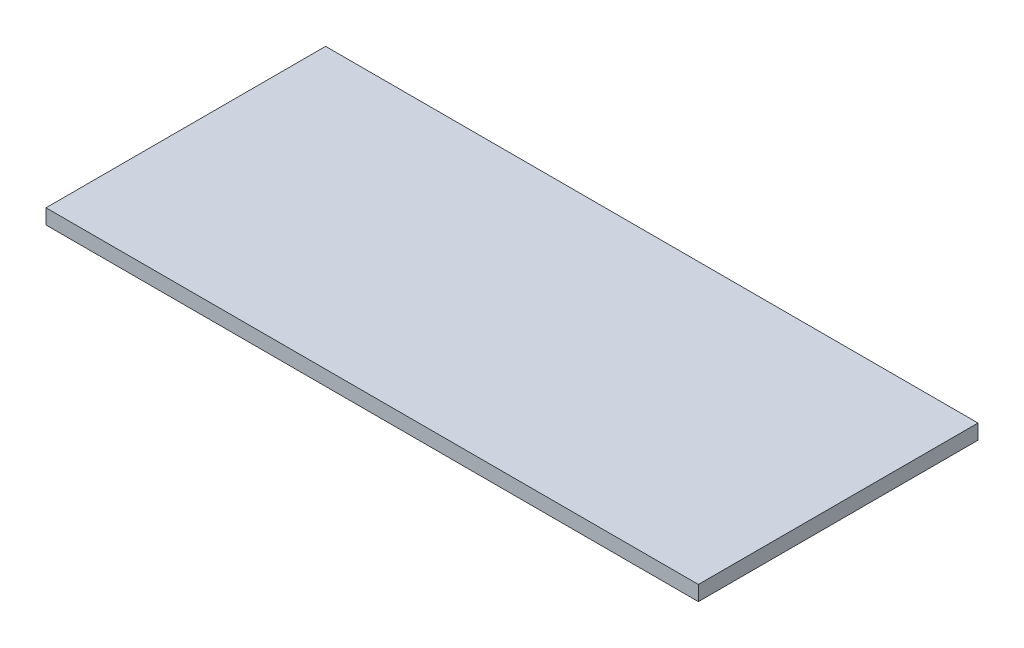
from build123d import *

# Parameters (mm, degrees)
SKETCH1_W           = 70
SKETCH1_H           = 30
BOSS_EXTRUDE1_DEPTH = 1.6


with BuildPart() as part:
    # Sketch1 → Boss-Extrude1 (new body)
    with BuildSketch(Plane(origin=(0, 0, 0), x_dir=(1, 0, 0), z_dir=(0, 1, 0))):
        Rectangle(SKETCH1_W, SKETCH1_H)
    extrude(amount=BOSS_EXTRUDE1_DEPTH)


solid = part.part
